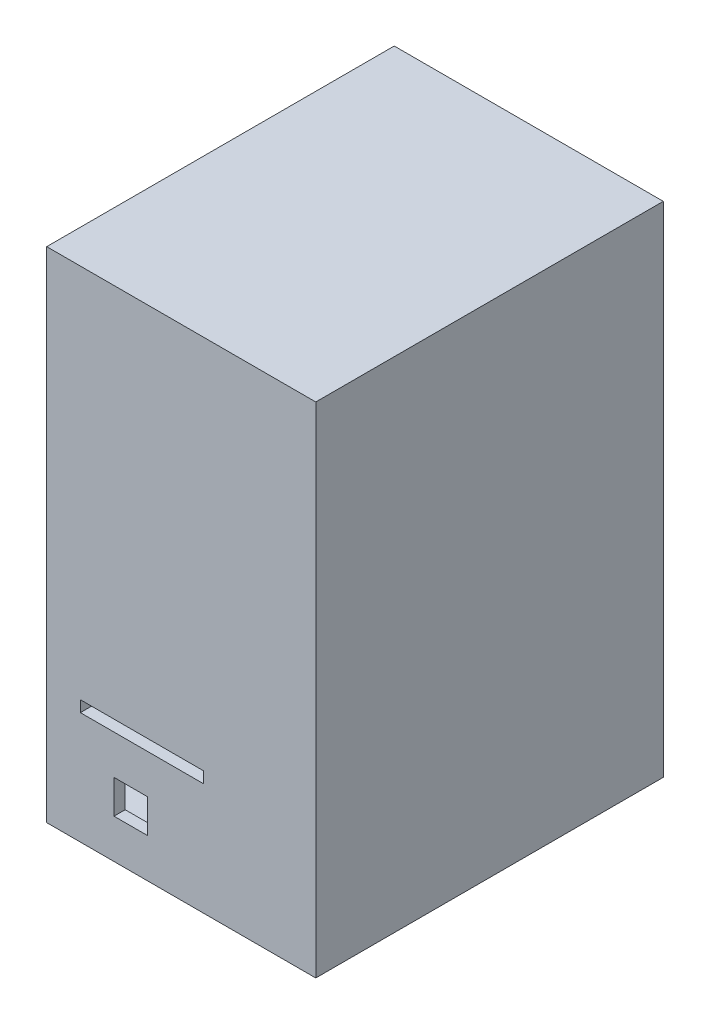
from build123d import *

# Parameters (mm, degrees)
SKETCH2_W           = 240
SKETCH2_H           = 445
BOSS_EXTRUDE1_DEPTH = 340
SHELL1_T            = 10
SKETCH4_W           = 50
SKETCH4_H           = 480.945679707
CUT_EXTRUDE2_DEPTH  = 479
SKETCH5_W           = 230.907748099
SKETCH5_H           = 10
EXTRUDE_THIN1_DEPTH = 300
SKETCH7_W           = 10
SKETCH7_H           = 335
EXTRUDE_THIN2_DEPTH = 300
SKETCH8_W           = 34
SKETCH8_H           = 75
CUT_EXTRUDE3_DEPTH  = 27
BOSS_EXTRUDE2_START = -90
SKETCH9_R           = 35
BOSS_EXTRUDE2_DEPTH = 30
SKETCH11_W          = 92.836775162
SKETCH11_H          = 460.435852011
CUT_EXTRUDE4_DEPTH  = 621
SKETCH14_W          = 65.396333165
SKETCH14_H          = 371.328598134
CUT_EXTRUDE8_DEPTH  = 490
SKETCH15_W          = 240
SKETCH15_H          = 445
BOSS_EXTRUDE3_DEPTH = 10
SKETCH16_W          = 110
SKETCH16_H          = 10
CUT_EXTRUDE9_DEPTH  = 10
SKETCH17_W          = 30
SKETCH17_H          = 30
CUT_EXTRUDE10_DEPTH = 10


with BuildPart() as part:
    # Sketch2 → Boss-Extrude1 (new body)
    with BuildSketch(Plane.XY):
        with Locations((48.923076923, -69.269230769)):
            Rectangle(SKETCH2_W, SKETCH2_H)
    extrude(amount=-BOSS_EXTRUDE1_DEPTH)

    # Shell1 (no face opened: a closed hollow body)
    add(offset(amount=-SHELL1_T, mode=Mode.PRIVATE), mode=Mode.SUBTRACT)

    # Sketch4 → Cut-Extrude2 (cut)
    with BuildSketch(Plane.ZY.offset(71.076923077)):
        with Locations((-15, -73.722431508)):
            Rectangle(SKETCH4_W, SKETCH4_H)
    extrude(amount=-CUT_EXTRUDE2_DEPTH, mode=Mode.SUBTRACT)

    # Sketch5 → Extrude-Thin1 (add)
    with BuildSketch(Plane.XY.offset(-330)):
        with Locations((54.376950972, -196.769230769)):
            Rectangle(SKETCH5_W, SKETCH5_H)
    extrude(amount=EXTRUDE_THIN1_DEPTH)

    # Sketch8 → Cut-Extrude3 (cut)
    with BuildSketch(Plane(origin=(0, -191.769230769, 0), x_dir=(1, 0, 0), z_dir=(0, 1, 0))):
        with Locations((3.923076923, 122.5)):
            Rectangle(SKETCH8_W, SKETCH8_H)
    extrude(amount=-CUT_EXTRUDE3_DEPTH, mode=Mode.SUBTRACT)

    # Sketch11 → Cut-Extrude4 (cut)
    with BuildSketch(Plane.XY.offset(-40)):
        with Locations((215.341464504, -76.987156774)):
            Rectangle(SKETCH11_W, SKETCH11_H)
    extrude(amount=-CUT_EXTRUDE4_DEPTH, mode=Mode.SUBTRACT)


with BuildPart() as body_2:
    # Sketch7 → Extrude-Thin2 (new body)
    with BuildSketch(Plane.XY.offset(-330)):
        with Locations((73.923076923, -24.269230769)):
            Rectangle(SKETCH7_W, SKETCH7_H)
    extrude(amount=EXTRUDE_THIN2_DEPTH)


with BuildPart() as body_3:
    # Sketch9 → Boss-Extrude2 (new body)
    with BuildSketch(Plane.ZY.offset(71.076923077).offset(BOSS_EXTRUDE2_START)):
        with Locations((-135, -201.769230769)):
            Circle(SKETCH9_R)
    extrude(amount=BOSS_EXTRUDE2_DEPTH)


with BuildPart() as cut_extrude8_tool:
    # Sketch14 → Cut-Extrude8 (new body)
    with BuildSketch(Plane.ZY.offset(61.076923077)):
        with Locations((-7.301833417, -16.104931702)):
            Rectangle(SKETCH14_W, SKETCH14_H)
    extrude(amount=-CUT_EXTRUDE8_DEPTH)


with BuildPart() as part_1:
    add(part.part)

    # Cut-Extrude8: cut by cut_extrude8_tool
    add(cut_extrude8_tool.part, mode=Mode.SUBTRACT)



with BuildPart() as body_2_1:
    add(body_2.part)

    # Cut-Extrude8: cut by cut_extrude8_tool
    add(cut_extrude8_tool.part, mode=Mode.SUBTRACT)


with BuildPart() as part_2:
    add(part_1.part)

    add(body_2_1.part)  # Boss-Extrude3 merges body 2
    # Sketch15 → Boss-Extrude3 (add)
    with BuildSketch(Plane.XY.offset(-40)):
        with Locations((48.923076923, -69.269230769)):
            Rectangle(SKETCH15_W, SKETCH15_H)
    extrude(amount=BOSS_EXTRUDE3_DEPTH)

    # Sketch16 → Cut-Extrude9 (cut)
    with BuildSketch(Plane.XY.offset(-30)):
        with Locations((13.923076923, -186.769230769)):
            Rectangle(SKETCH16_W, SKETCH16_H)
    extrude(amount=-CUT_EXTRUDE9_DEPTH, mode=Mode.SUBTRACT)

    # Sketch17 → Cut-Extrude10 (cut)
    with BuildSketch(Plane.XY.offset(-30)):
        with Locations((3.923076923, -241.769230769)):
            Rectangle(SKETCH17_W, SKETCH17_H)
    extrude(amount=-CUT_EXTRUDE10_DEPTH, mode=Mode.SUBTRACT)


solid = Compound([body_3.part, part_2.part])
